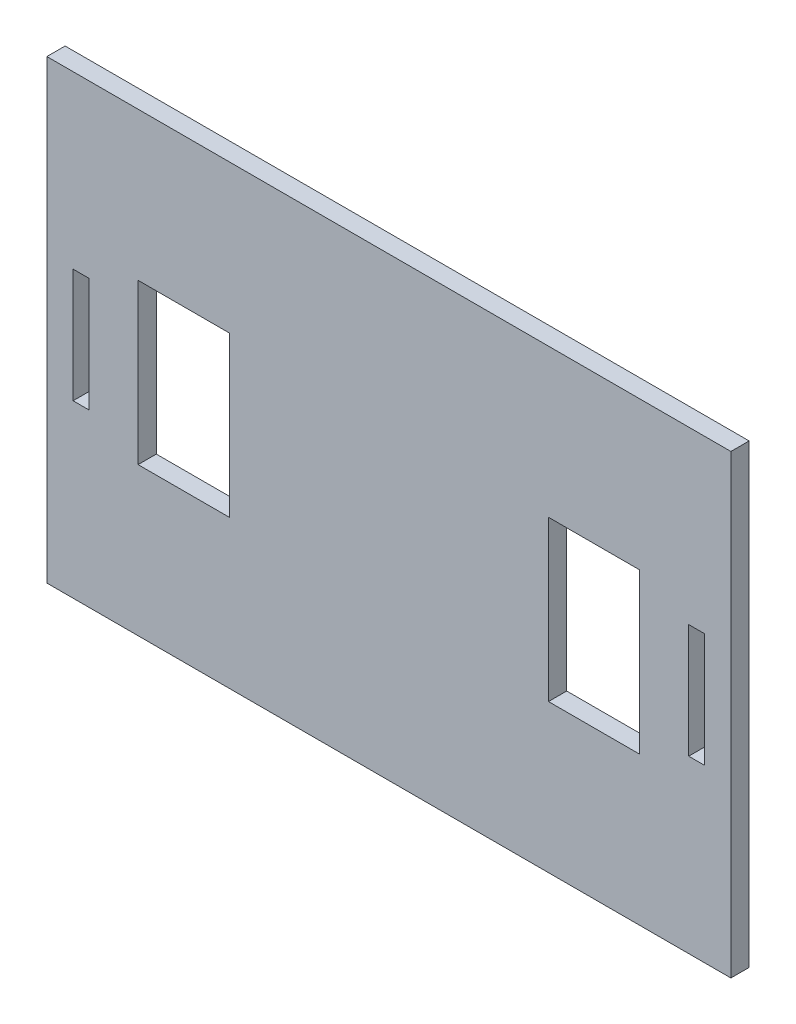
from build123d import *

# Parameters (mm, degrees)
ESQUISSE1_W             = 300
ESQUISSE1_H             = 200
BOSS_EXTRU_1_DEPTH      = 8
ESQUISSE2_W             = 40
ESQUISSE2_H             = 70
ESQUISSE2_W_2           = 7
ESQUISSE2_H_2           = 50
ENL_V_MAT_EXTRU_1_DEPTH = 361.643868657


with BuildPart() as part:
    # Esquisse1 → Boss.-Extru.1 (new body)
    with BuildSketch(Plane.XY):
        with Locations((150, 100)):
            Rectangle(ESQUISSE1_W, ESQUISSE1_H)
    extrude(amount=BOSS_EXTRU_1_DEPTH)

    # Esquisse2 → Enlèv. mat.-Extru.1 (cut, through all)
    with BuildSketch(Plane.XY.offset(8)):
        with Locations((60, 100)):
            Rectangle(ESQUISSE2_W, ESQUISSE2_H)
        with Locations((15, 100)):
            Rectangle(ESQUISSE2_W_2, ESQUISSE2_H_2)
        with Locations((285, 100)):
            Rectangle(ESQUISSE2_W_2, ESQUISSE2_H_2)
        with Locations((240, 100)):
            Rectangle(ESQUISSE2_W, ESQUISSE2_H)
    extrude(amount=-ENL_V_MAT_EXTRU_1_DEPTH, mode=Mode.SUBTRACT)


solid = part.part
